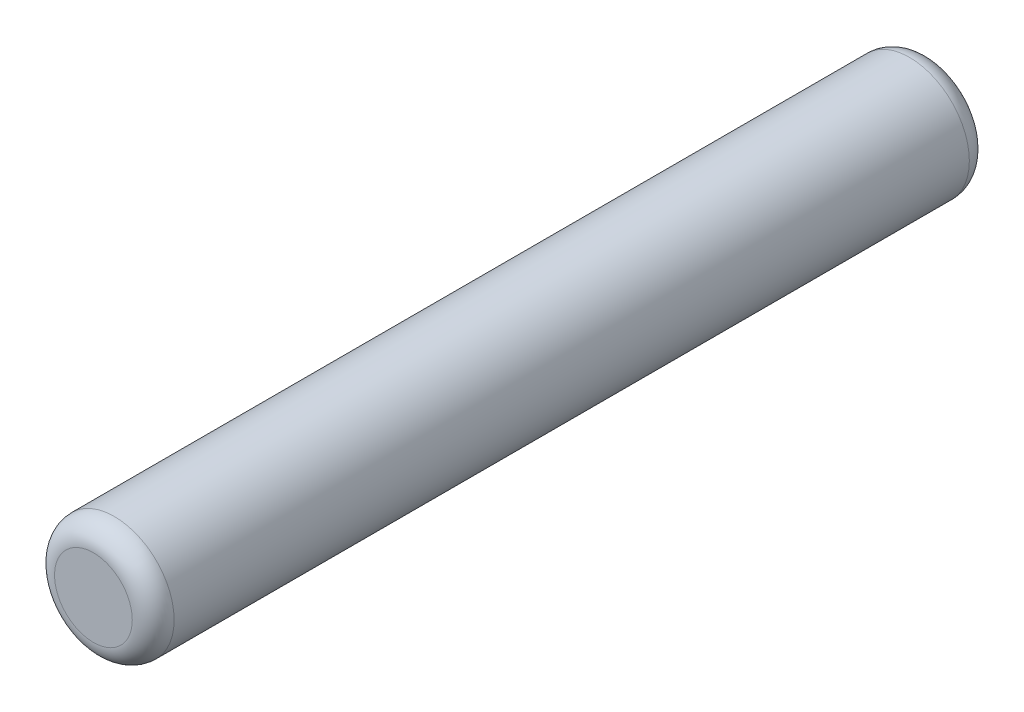
from build123d import *

# Parameters (mm, degrees)
SKETCH1_R           = 1
BOSS_EXTRUDE1_DEPTH = 7
FILLET1_R           = 0.35


with BuildPart() as part:
    # Sketch1 → Boss-Extrude1 (new, symmetric)
    with BuildSketch(Plane.XY):
        Circle(SKETCH1_R)
    extrude(amount=BOSS_EXTRUDE1_DEPTH, both=True)

    # Fillet1
    fillet1_edges = [part.edges().sort_by_distance(p)[0] for p in [
        (-1, 0, -7),
        (-1, 0, 7),
    ]]
    fillet(fillet1_edges, radius=FILLET1_R)


solid = part.part
